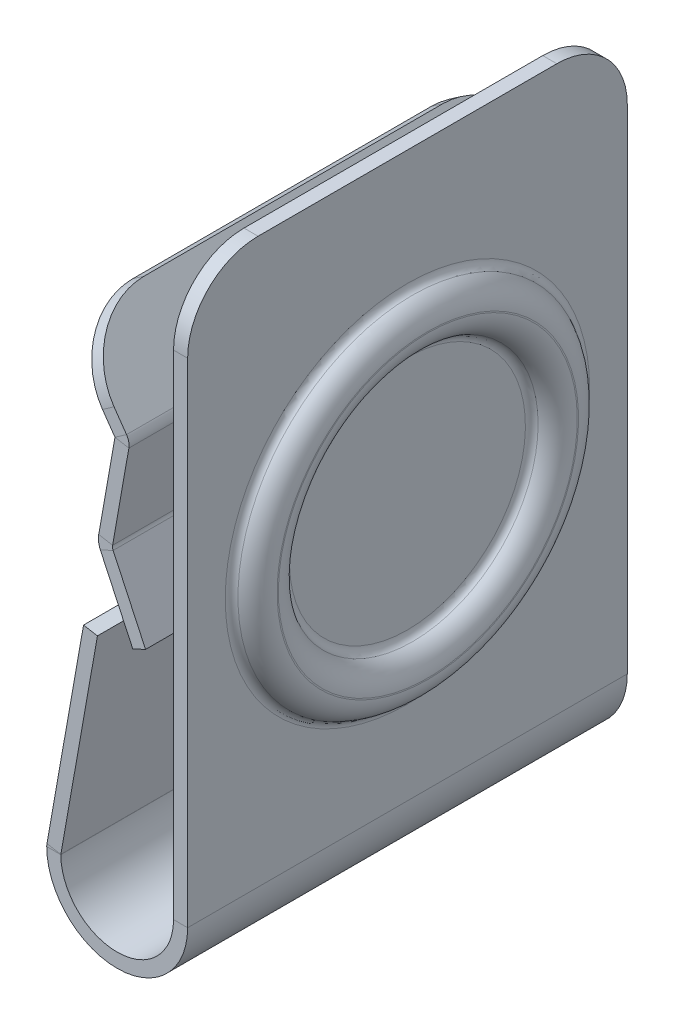
from build123d import *

# Parameters (mm, degrees)
BASE_FLANGE1_START  = -7.9248
BASE_FLANGE1_DEPTH  = 7.9248
EDGE_FLANGE1_START  = -7.9248
EDGE_FLANGE1_DEPTH  = 7.9248
FILLET1_R           = 1.27
CUT_EXTRUDE1_REACH  = 16.094
SKETCH9_W           = 1.27
SKETCH9_H           = 1.5748
EDGE_FLANGE2_DEPTH  = 1.2192
SKETCH13_R          = 3.175
SKETCH13_R_2        = 2.2352
BOSS_EXTRUDE1_DEPTH = 0.36703
FILLET2_R           = 0.4699
FILLET3_R           = 0.1524


# Read off the part's stored shape, not the designer's step: Base-Flange1, Edge-Flange1, SurfaceCut2
# Sheet-metal steps are written as plain solids
with BuildPart() as part:
    # Base-Flange1 outline → Base-Flange1 (new body)
    with BuildSketch(Plane.XY.offset(BASE_FLANGE1_START)):
        with BuildLine():
            ThreePointArc((-2.031997476, -10.162264875), (-2.031903336, -10.160022702), (-2.031611656, -10.157797589))
            Line((-2.031611656, -10.157797589), (-0.805189502, -3.202411927))
            Line((-0.805189502, -3.202411927), (-1.055330671, -3.15830529))
            Line((-1.055330671, -3.15830529), (-2.281752825, -10.113690952))
            ThreePointArc((-2.281752825, -10.113690952), (-2.284961307, -10.138167189), (-2.285996844, -10.162831094))
            ThreePointArc((-2.285996844, -10.162831094), (-1.014584452, -11.429999211), (0.254, -10.16))
            Line((0.254, -10.16), (0.254, 0))
            Line((0.254, 0), (0, 0))
            Line((0, 0), (0, -10.16))
            ThreePointArc((0, -10.16), (-1.014867562, -11.175999369), (-2.031997476, -10.162264875))
        make_face()
    extrude(amount=BASE_FLANGE1_DEPTH)

    # Edge-Flange1 outline → Edge-Flange1 (add)
    with BuildSketch(Plane.XY.offset(EDGE_FLANGE1_START)):
        with BuildLine():
            Line((-1.055330671, -3.15830529), (-0.805189502, -3.202411927))
            ThreePointArc((-0.805189502, -3.202411927), (-0.807351486, -3.103329628), (-0.847266052, -3.012616875))
            Line((-0.847266052, -3.012616875), (-1.800680468, -1.650999977))
            Line((-1.800680468, -1.650999977), (-2.008745087, -1.796688392))
            Line((-2.008745087, -1.796688392), (-1.055330671, -3.15830529))
        make_face()
    extrude(amount=EDGE_FLANGE1_DEPTH)

    # Fillet1
    fillet1_edges = [part.edges().sort_by_distance(p)[0] for p in [
        (0.127, 0, -7.9248),
        (-1.904712777, -1.723844184, -7.9248),
        (-1.904712777, -1.723844184, 0),
        (0.127, 0, 0),
    ]]
    fillet(fillet1_edges, radius=FILLET1_R)

    # Sketch9 → Cut-Extrude1 (cut, up to next)
    with BuildSketch(Plane(origin=(-0.483406544, 0.085237616, 0), x_dir=(0, 0, 1), z_dir=(-0.9848077530122094, 0.1736481776669234, 0)), mode=Mode.PRIVATE) as cut_extrude1_sk1:
        with Locations((-7.2898, -5.770256905)):
            Rectangle(SKETCH9_W, SKETCH9_H)
    cut_extrude1_tool1 = extrude(cut_extrude1_sk1.sketch, amount=-CUT_EXTRUDE1_REACH, mode=Mode.PRIVATE) & part.part
    cut_extrude1 = cut_extrude1_tool1.solids().sort_by_distance((-1.485401, -5.597356, -7.2898))[0]
    add(cut_extrude1, mode=Mode.SUBTRACT)

    # Edge-Flange2 section (across the edge) → Edge-Flange2 (add)
    with BuildSketch(Plane(origin=(-1.10548278, -4.905459737, -6.7056), x_dir=(0.9063077870366494, 0.42261826174070094, 0), z_dir=(0, 0, -1))):
        with BuildLine():
            Line((-0.254, 0.040042946), (-0.254, 1.4224))
            Line((-0.254, 1.4224), (0, 1.4224))
            Line((0, 1.4224), (0, 0.040042946))
            ThreePointArc((0, 0.040042946), (0.005877947, 0.00185331), (0.02296769, -0.032801261))
            Line((0.02296769, -0.032801261), (-0.185096929, -0.178489676))
            ThreePointArc((-0.185096929, -0.178489676), (-0.236366158, -0.074525963), (-0.254, 0.040042946))
        make_face()
    edge_flange2 = extrude(amount=EDGE_FLANGE2_DEPTH)

    # Mirror1: Cut-Extrude1, Edge-Flange2 across plane
    add(cut_extrude1.mirror(Plane(origin=(0, 0, -3.9624), x_dir=(1, 0, 0), z_dir=(0, 0, -1))), mode=Mode.SUBTRACT)
    add(edge_flange2.mirror(Plane(origin=(0, 0, -3.9624), x_dir=(1, 0, 0), z_dir=(0, 0, -1))))

    # Sketch13 → Boss-Extrude1 (add)
    with BuildSketch(Plane(origin=(0.254, 0, 0), x_dir=(0, 0, -1), z_dir=(1, 0, 0))):
        with Locations(Location((3.9624, -5.36702, 0), (0, 0, 270))):
            Circle(SKETCH13_R)
        with Locations(Location((3.9624, -5.36702, 0), (0, 0, 90))):
            Circle(SKETCH13_R_2, mode=Mode.SUBTRACT)
    extrude(amount=BOSS_EXTRUDE1_DEPTH)

    # Fillet2
    # the kernel refuses this fillet: 0.4699 mm, written as the material it takes off along each edge
    with BuildSketch(Plane(origin=(0.62103, -5.36702, -3.9624), x_dir=(0, -1, 0), z_dir=(0, 0, 1))) as fillet2_piece_1:
        with BuildLine():
            CenterArc((2.716498339, -0.4699), FILLET2_R, 12.645543845, 77.354456155)
            Line((2.716498339, 0), (2.716498339, 0.009398))
            Line((2.716498339, 0.009398), (3.175, 0.009398))
            Line((3.175, 0.009398), (3.184398, 0))
            ThreePointArc((3.184398, 0), (3.184398, -0.183515), (3.184170033, -0.3649726))
            Line((3.184170033, -0.3649726), (3.175, -0.36703))
        make_face()
    revolve(axis=Axis((0.62103, -5.36702, -3.9624), (1, 0, 0)), mode=Mode.SUBTRACT)
    with BuildSketch(Plane(origin=(0.62103, -5.36702, -3.9624), x_dir=(0, 1, 0), z_dir=(0, 0, -1))) as fillet2_piece_2:
        with BuildLine():
            CenterArc((2.693701661, -0.4699), FILLET2_R, 90, 77.354456155)
            Line((2.2352, -0.36703), (2.226029967, -0.3649726))
            ThreePointArc((2.226029967, -0.3649726), (2.225802, -0.183515), (2.225802, 0))
            Line((2.225802, 0), (2.2352, 0.009398))
            Line((2.2352, 0.009398), (2.693701661, 0.009398))
            Line((2.693701661, 0.009398), (2.693701661, 0))
        make_face()
    revolve(axis=Axis((0.62103, -5.36702, -3.9624), (1, 0, 0)), mode=Mode.SUBTRACT)

    # Fillet3
    fillet3_edges = [part.edges().sort_by_distance(p)[0] for p in [
        (0.254, -2.19202, -3.9624),
        (0.254, -7.60222, -3.9624),
    ]]
    fillet(fillet3_edges, radius=FILLET3_R)

    # SurfaceCut2 outline → SurfaceCut2 (revolve, cut)
    with BuildSketch(Plane(origin=(0, -5.36702, -3.9624), x_dir=(0, 1, 0), z_dir=(0, 0, -1))):
        with BuildLine():
            Line((2.716498339, 0.36703), (2.693701661, 0.36703))
            ThreePointArc((2.693701661, 0.36703), (2.576458228, 0.332421995), (2.496802209, 0.239693061))
            ThreePointArc((2.496802209, 0.239693061), (2.346861467, 0.06514448), (2.126167946, 0))
            Line((2.126167946, 0), (3.284032054, 0))
            ThreePointArc((3.284032054, 0), (3.063338533, 0.06514448), (2.913397791, 0.239693061))
            ThreePointArc((2.913397791, 0.239693061), (2.833741772, 0.332421995), (2.716498339, 0.36703))
        make_face()
    revolve(axis=Axis((0, -5.36702, -3.9624), (1, 0, 0)), mode=Mode.SUBTRACT)


solid = part.part
